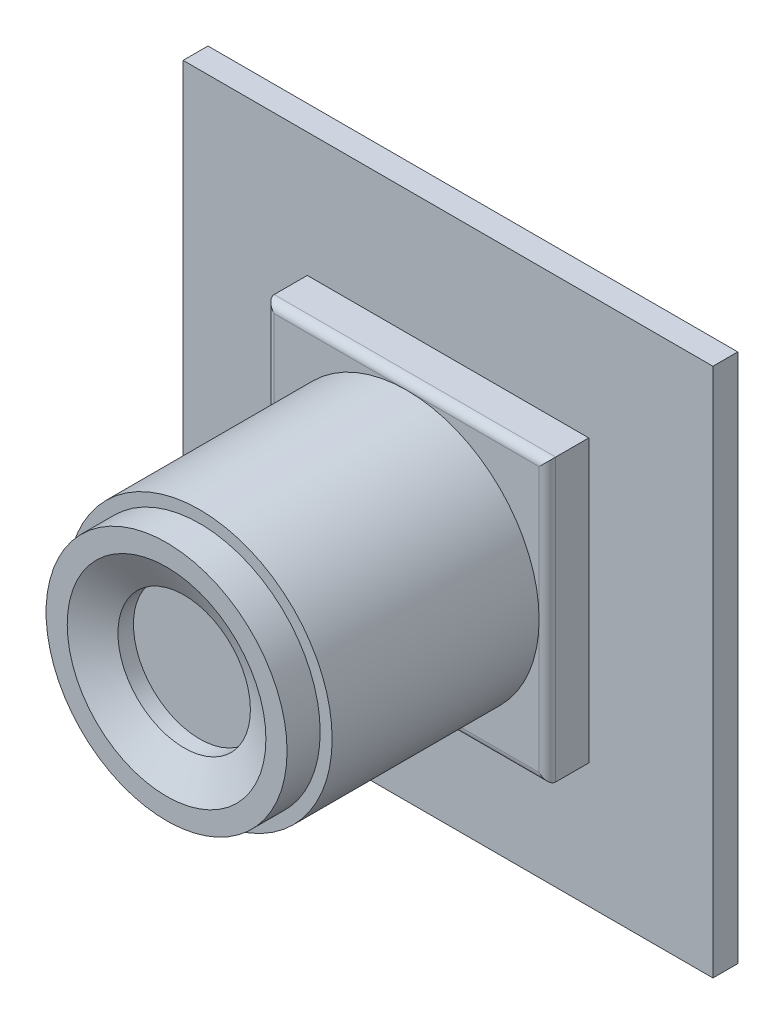
from build123d import *

# Parameters (mm, degrees)
SKETCH1_W           = 32
SKETCH1_H           = 32
BOSS_EXTRUDE1_DEPTH = 1.5
SKETCH3_W           = 17
SKETCH3_H           = 17
BOSS_EXTRUDE2_DEPTH = 2.5
SKETCH4_R           = 8
BOSS_EXTRUDE3_DEPTH = 12.5
SKETCH5_R           = 7.277770315
BOSS_EXTRUDE4_DEPTH = 2
SKETCH6_R           = 4
CUT_EXTRUDE1_DEPTH  = 2
CHAMFER1_SIZE       = 2
CHAMFER1_SIZE2      = 1.063418863
FILLET2_R           = 0.5


with BuildPart() as part:
    # Sketch1 → Boss-Extrude1 (new body)
    with BuildSketch(Plane.XY):
        Rectangle(SKETCH1_W, SKETCH1_H)
    extrude(amount=BOSS_EXTRUDE1_DEPTH)

    # Sketch3 → Boss-Extrude2 (add)
    with BuildSketch(Plane.XY.offset(1.5)):
        Rectangle(SKETCH3_W, SKETCH3_H)
    extrude(amount=BOSS_EXTRUDE2_DEPTH)

    # Sketch4 → Boss-Extrude3 (add)
    with BuildSketch(Plane.XY.offset(4)):
        with Locations(Location((0, 0, 0), (0, 0, 180))):
            Circle(SKETCH4_R)
    extrude(amount=BOSS_EXTRUDE3_DEPTH)

    # Sketch5 → Boss-Extrude4 (add)
    with BuildSketch(Plane.XY.offset(16.5)):
        Circle(SKETCH5_R)
    extrude(amount=BOSS_EXTRUDE4_DEPTH)

    # Sketch6 → Cut-Extrude1 (cut)
    with BuildSketch(Plane.XY.offset(18.5)):
        Circle(SKETCH6_R)
    extrude(amount=-CUT_EXTRUDE1_DEPTH, mode=Mode.SUBTRACT)

    # Chamfer1
    chamfer1_edges = [part.edges().sort_by_distance(p)[0] for p in [
        (-4, 0, 18.5),
    ]]
    chamfer1_side = [part.faces().sort_by_distance(p)[0] for p in [
        (-7.071923885, 0, 18.5),
    ]]
    chamfer(chamfer1_edges, length=CHAMFER1_SIZE, length2=CHAMFER1_SIZE2, reference=chamfer1_side[0])

    # Fillet2
    fillet2_edges = [part.edges().sort_by_distance(p)[0] for p in [
        (8.5, 0, 4),
        (0, 8.5, 4),
        (-8.5, 0, 4),
        (0, -8.5, 4),
    ]]
    fillet(fillet2_edges, radius=FILLET2_R - 0.0001)  # a hair under: the kernel refuses the full size


solid = part.part
